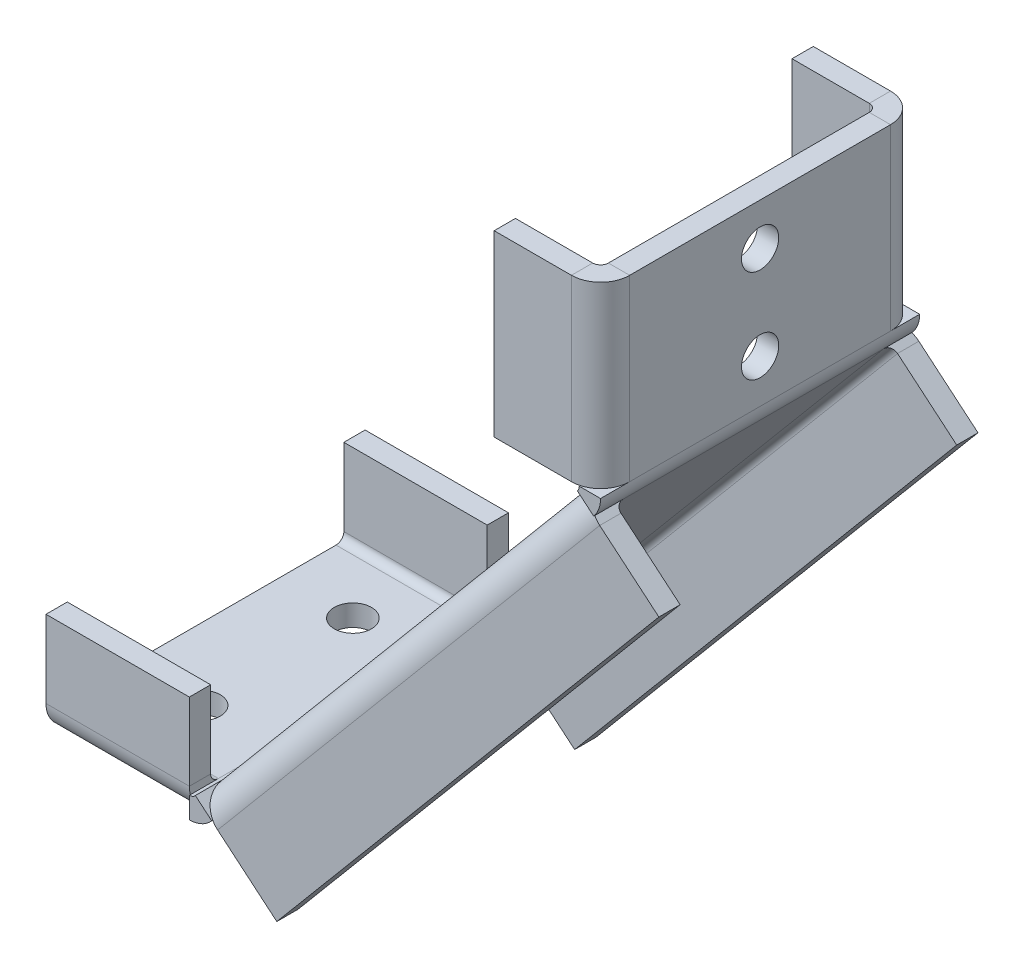
from build123d import *

# Parameters (mm, degrees)
BASE_FLANGE1_DEPTH             = 30
EDGE_FLANGE1_STRIP_W           = 9.4732
EDGE_FLANGE1_STRIP_H           = 2
EDGE_FLANGE1_STRIP_CUT_DEPTH   = 16.803293835
EDGE_FLANGE1_STRIP_2_W         = 9.4732
EDGE_FLANGE1_STRIP_2_H         = 2
EDGE_FLANGE1_STRIP_CUT_2_DEPTH = 13.476690823
EDGE_FLANGE1_STRIP_3_W         = 9.4732
EDGE_FLANGE1_STRIP_3_H         = 2
EDGE_FLANGE1_STRIP_CUT_3_DEPTH = 16.803293835
EDGE_FLANGE1_STRIP_4_W         = 9.4732
EDGE_FLANGE1_STRIP_4_H         = 2
EDGE_FLANGE1_STRIP_CUT_4_DEPTH = 13.476690823
EDGE_FLANGE1_DEPTH             = 16.803293835
EDGE_FLANGE1_BEND_DEPTH        = 13.476690823
EDGE_FLANGE1_BEND_2_DEPTH      = 16.803293835
EDGE_FLANGE1_BEND_3_DEPTH      = 13.476690823
EDGE_FLANGE2_STRIP_W           = 9.4732
EDGE_FLANGE2_STRIP_H           = 2
EDGE_FLANGE2_STRIP_CUT_DEPTH   = 55.838043997
EDGE_FLANGE2_STRIP_2_W         = 9.4732
EDGE_FLANGE2_STRIP_2_H         = 2
EDGE_FLANGE2_STRIP_CUT_2_DEPTH = 55.838043997
EDGE_FLANGE2_DEPTH             = 55.838043997
EDGE_FLANGE2_BEND_DEPTH        = 55.838043997
SKETCH32_R                     = 1.75
CUT_EXTRUDE1_DEPTH             = 10
SKETCH33_R                     = 1.75
CUT_EXTRUDE2_DEPTH             = 10


# Sheet-metal steps are written as plain solids
with BuildPart() as part:
    # Sketch1 → Base-Flange1 (new body)
    with BuildSketch(Plane.XY):
        with BuildLine():
            Line((0, 0), (13.476690823, 0))
            ThreePointArc((13.476690823, 0), (13.787790598, 0.068920069), (14.040674196, 0.262783248))
            Line((14.040674196, 0.262783248), (49.95840521, 43.015604865))
            ThreePointArc((49.95840521, 43.015604865), (50.086523604, 43.237281371), (50.131021837, 43.489421617))
            Line((50.131021837, 43.489421617), (50.131021837, 60.292715453))
            Line((50.131021837, 60.292715453), (52.131021837, 60.292715453))
            Line((52.131021837, 60.292715453), (52.131021837, 43.489421617))
            ThreePointArc((52.131021837, 43.489421617), (51.965702989, 42.552675762), (51.489720369, 41.729108117))
            Line((51.489720369, 41.729108117), (15.571989355, -1.023713501))
            ThreePointArc((15.571989355, -1.023713501), (14.632481815, -1.743949686), (13.476690823, -2))
            Line((13.476690823, -2), (0, -2))
            Line((0, -2), (0, 0))
        make_face()
    extrude(amount=BASE_FLANGE1_DEPTH)

    # Edge-Flange1 strip (across the edge) → Edge-Flange1 strip cut (cut)
    with BuildSketch(Plane(origin=(50.131021837, 43.489421617, 30), x_dir=(0, 0, -1), z_dir=(0, 1, 0))):
        with Locations((-2, -1)):
            Rectangle(EDGE_FLANGE1_STRIP_W, EDGE_FLANGE1_STRIP_H)
    extrude(amount=EDGE_FLANGE1_STRIP_CUT_DEPTH, mode=Mode.SUBTRACT)

    # Edge-Flange1 strip 2 (across the edge) → Edge-Flange1 strip cut 2 (cut)
    with BuildSketch(Plane(origin=(0, 0, 30), x_dir=(0, 0, -1), z_dir=(1, 0, 0))):
        with Locations((-2, -1)):
            Rectangle(EDGE_FLANGE1_STRIP_2_W, EDGE_FLANGE1_STRIP_2_H)
    extrude(amount=EDGE_FLANGE1_STRIP_CUT_2_DEPTH, mode=Mode.SUBTRACT)

    # Edge-Flange1 strip 3 (across the edge) → Edge-Flange1 strip cut 3 (cut)
    with BuildSketch(Plane(origin=(50.131021837, 60.292715453, 0), x_dir=(0, 0, 1), z_dir=(0, -1, 0))):
        with Locations((-2, -1)):
            Rectangle(EDGE_FLANGE1_STRIP_3_W, EDGE_FLANGE1_STRIP_3_H)
    extrude(amount=EDGE_FLANGE1_STRIP_CUT_3_DEPTH, mode=Mode.SUBTRACT)

    # Edge-Flange1 strip 4 (across the edge) → Edge-Flange1 strip cut 4 (cut)
    with BuildSketch(Plane.ZY.offset(-13.476690823)):
        with Locations((-2, -1)):
            Rectangle(EDGE_FLANGE1_STRIP_4_W, EDGE_FLANGE1_STRIP_4_H)
    extrude(amount=EDGE_FLANGE1_STRIP_CUT_4_DEPTH, mode=Mode.SUBTRACT)

    # Edge-Flange1 section (across the edge) → Edge-Flange1 (add)
    with BuildSketch(Plane(origin=(50.131021837, 43.489421617, 30), x_dir=(0, 0, -1), z_dir=(0, 1, 0))):
        with BuildLine():
            Line((0, 0.7366), (0, 8))
            Line((0, 8), (2, 8))
            Line((2, 8), (2, 0.7366))
            ThreePointArc((2, 0.7366), (2.215745145, 0.215745145), (2.7366, 0))
            Line((2.7366, 0), (2.7366, -2))
            ThreePointArc((2.7366, -2), (0.801531583, -1.198468417), (0, 0.7366))
        make_face()
    extrude(amount=EDGE_FLANGE1_DEPTH)

    # Edge-Flange1 section 2 (across the edge) → Edge-Flange1 bend (add)
    with BuildSketch(Plane(origin=(0, 0, 30), x_dir=(0, 0, -1), z_dir=(1, 0, 0))):
        with BuildLine():
            Line((0, 0.7366), (0, 8))
            Line((0, 8), (2, 8))
            Line((2, 8), (2, 0.7366))
            ThreePointArc((2, 0.7366), (2.215745145, 0.215745145), (2.7366, 0))
            Line((2.7366, 0), (2.7366, -2))
            ThreePointArc((2.7366, -2), (0.801531583, -1.198468417), (0, 0.7366))
        make_face()
    extrude(amount=EDGE_FLANGE1_BEND_DEPTH)

    # Edge-Flange1 section 3 (across the edge) → Edge-Flange1 bend 2 (add)
    with BuildSketch(Plane(origin=(50.131021837, 60.292715453, 0), x_dir=(0, 0, 1), z_dir=(0, -1, 0))):
        with BuildLine():
            Line((0, 0.7366), (0, 8))
            Line((0, 8), (2, 8))
            Line((2, 8), (2, 0.7366))
            ThreePointArc((2, 0.7366), (2.215745145, 0.215745145), (2.7366, 0))
            Line((2.7366, 0), (2.7366, -2))
            ThreePointArc((2.7366, -2), (0.801531583, -1.198468417), (0, 0.7366))
        make_face()
    extrude(amount=EDGE_FLANGE1_BEND_2_DEPTH)

    # Edge-Flange1 section 4 (across the edge) → Edge-Flange1 bend 3 (add)
    with BuildSketch(Plane.ZY.offset(-13.476690823)):
        with BuildLine():
            Line((0, 0.7366), (0, 8))
            Line((0, 8), (2, 8))
            Line((2, 8), (2, 0.7366))
            ThreePointArc((2, 0.7366), (2.215745145, 0.215745145), (2.7366, 0))
            Line((2.7366, 0), (2.7366, -2))
            ThreePointArc((2.7366, -2), (0.801531583, -1.198468417), (0, 0.7366))
        make_face()
    extrude(amount=EDGE_FLANGE1_BEND_3_DEPTH)

    # Edge-Flange2 strip (across the edge) → Edge-Flange2 strip cut (cut)
    with BuildSketch(Plane(origin=(51.489720369, 41.729108117, 30), x_dir=(0, 0, -1), z_dir=(-0.6432483740966664, -0.7656575796150621, 0))):
        with Locations((-2, -1)):
            Rectangle(EDGE_FLANGE2_STRIP_W, EDGE_FLANGE2_STRIP_H)
    extrude(amount=EDGE_FLANGE2_STRIP_CUT_DEPTH, mode=Mode.SUBTRACT)

    # Edge-Flange2 strip 2 (across the edge) → Edge-Flange2 strip cut 2 (cut)
    with BuildSketch(Plane(origin=(15.571989355, -1.023713501, 0), x_dir=(0, 0, 1), z_dir=(0.6432483740966664, 0.7656575796150621, 0))):
        with Locations((-2, -1)):
            Rectangle(EDGE_FLANGE2_STRIP_2_W, EDGE_FLANGE2_STRIP_2_H)
    extrude(amount=EDGE_FLANGE2_STRIP_CUT_2_DEPTH, mode=Mode.SUBTRACT)

    # Edge-Flange2 section (across the edge) → Edge-Flange2 (add)
    with BuildSketch(Plane(origin=(51.489720369, 41.729108117, 30), x_dir=(0, 0, -1), z_dir=(-0.6432483740966664, -0.7656575796150621, 0))):
        with BuildLine():
            Line((0, 0.7366), (0, 8))
            Line((0, 8), (2, 8))
            Line((2, 8), (2, 0.7366))
            ThreePointArc((2, 0.7366), (2.215745145, 0.215745145), (2.7366, 0))
            Line((2.7366, 0), (2.7366, -2))
            ThreePointArc((2.7366, -2), (0.801531583, -1.198468417), (0, 0.7366))
        make_face()
    extrude(amount=EDGE_FLANGE2_DEPTH)

    # Edge-Flange2 section 2 (across the edge) → Edge-Flange2 bend (add)
    with BuildSketch(Plane(origin=(15.571989355, -1.023713501, 0), x_dir=(0, 0, 1), z_dir=(0.6432483740966664, 0.7656575796150621, 0))):
        with BuildLine():
            Line((0, 0.7366), (0, 8))
            Line((0, 8), (2, 8))
            Line((2, 8), (2, 0.7366))
            ThreePointArc((2, 0.7366), (2.215745145, 0.215745145), (2.7366, 0))
            Line((2.7366, 0), (2.7366, -2))
            ThreePointArc((2.7366, -2), (0.801531583, -1.198468417), (0, 0.7366))
        make_face()
    extrude(amount=EDGE_FLANGE2_BEND_DEPTH)

    # Sketch32 → Cut-Extrude1 (cut)
    with BuildSketch(Plane(origin=(0, 0, 0), x_dir=(1, 0, 0), z_dir=(0, 1, 0))):
        with Locations(Location((6.738345411, -7.891027615, 0), (0, 0, 270))):
            Circle(SKETCH32_R)
        with Locations(Location((6.738345411, -22.108972385, 0), (0, 0, 270))):
            Circle(SKETCH32_R)
    extrude(amount=-CUT_EXTRUDE1_DEPTH, mode=Mode.SUBTRACT)

    # Sketch33 → Cut-Extrude2 (cut)
    with BuildSketch(Plane.ZY.offset(-50.131021837)):
        with Locations((15, 56.35303153)):
            Circle(SKETCH33_R)
        with Locations((15, 47.577872809)):
            Circle(SKETCH33_R)
    extrude(amount=-CUT_EXTRUDE2_DEPTH, mode=Mode.SUBTRACT)


solid = part.part
